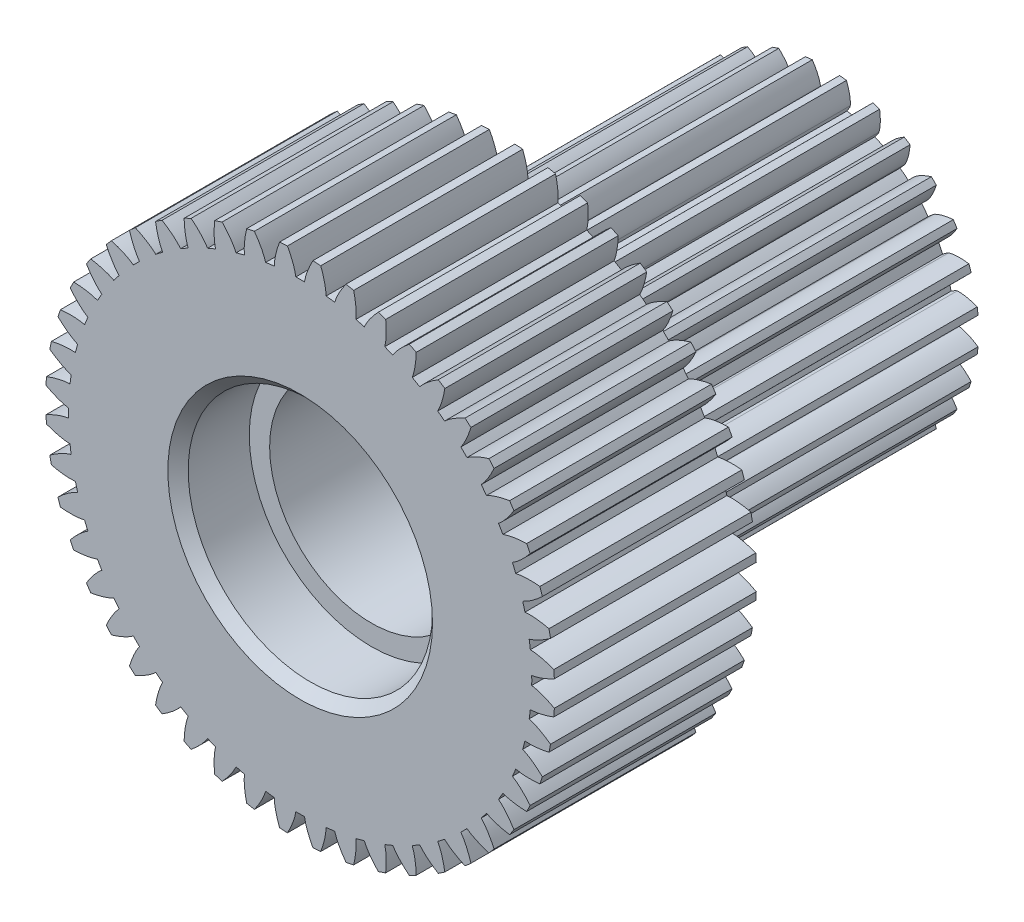
from build123d import *

# Parameters (mm, degrees)
SKETCH1_R           = 12.5
BOSS_EXTRUDE1_DEPTH = 4.959009305
CUT_EXTRUDE1_DEPTH  = 19.360059185
CIRPATTERN2_COUNT   = 48
SKETCH4_R           = 7.5
BOSS_EXTRUDE2_DEPTH = 15.90536252
CUT_EXTRUDE2_START  = -15.90536252
CUT_EXTRUDE2_DEPTH  = 15.90536252
CIRPATTERN3_COUNT   = 28
SKETCH3_R           = 5
CUT_EXTRUDE3_DEPTH  = 32.28205027
SKETCH7_R           = 6
CUT_EXTRUDE4_DEPTH  = 3.5
CHAMFER1_SIZE       = 0.5


with BuildPart() as part:
    # Sketch1 → Boss-Extrude1 (new, symmetric)
    with BuildSketch(Plane.XY):
        Circle(SKETCH1_R)
    extrude(amount=BOSS_EXTRUDE1_DEPTH, both=True)

    # Sketch2 → Cut-Extrude1 (cut, symmetric)
    with BuildSketch(Plane.XY):
        with BuildLine():
            ThreePointArc((11.375, 0), (11.374548456, -0.101352978), (11.373193859, -0.202697909))
            ThreePointArc((11.373193859, -0.202697909), (11.373112093, -0.207234919), (11.373028518, -0.211771896))
            add(Edge.make_bspline(
                [(11.373028518, -0.211771896), (11.380953526, -0.212987168), (11.401785423, -0.216332328), (11.441797627, -0.223452758), (11.500813641, -0.235700221), (11.57070435, -0.252432646), (11.646390258, -0.272969137), (11.721553813, -0.2955134), (11.796182124, -0.319908917), (11.870187127, -0.345925935), (11.959400335, -0.379458558), (12.065755817, -0.422467324), (12.189079832, -0.476789444), (12.31452904, -0.536847862), (12.406473441, -0.584161756), (12.462735627, -0.614203241), (12.484320484, -0.625893003)],
                knots=[0.035427308, 0.035427308, 0.035427308, 0.035427308, 0.035427308, 0.04661014, 0.064854849, 0.092110525, 0.119476176, 0.146842496, 0.174208854, 0.201574956, 0.228941013, 0.256307345, 0.307035032, 0.361767352, 0.416499661, 0.450790482, 0.450790482, 0.450790482, 0.450790482, 0.450790482], degree=4))
            ThreePointArc((12.484320484, -0.625893003), (12.496079506, -0.313044685), (12.5, 0))
            ThreePointArc((12.5, 0), (12.496095181, 0.312418356), (12.484383163, 0.624641521))
            add(Edge.make_bspline(
                [(11.373034654, 0.211442088), (11.381574139, 0.212737189), (11.403021273, 0.216159284), (11.443646662, 0.22337062), (11.503269369, 0.235743988), (11.573160079, 0.252476413), (11.648845987, 0.273012904), (11.724009541, 0.295557167), (11.798637852, 0.319952685), (11.872642856, 0.345969702), (11.961856063, 0.379502325), (12.068211545, 0.422511091), (12.191535561, 0.476833211), (12.316371806, 0.536598175), (12.40771357, 0.583580129), (12.463389424, 0.613285235), (12.484383163, 0.624641521)],
                knots=[0.034563274, 0.034563274, 0.034563274, 0.034563274, 0.034563274, 0.04661014, 0.064854849, 0.092110525, 0.119476176, 0.146842496, 0.174208854, 0.201574956, 0.228941013, 0.256307345, 0.307035032, 0.361767352, 0.416499661, 0.449840211, 0.449840211, 0.449840211, 0.449840211, 0.449840211], degree=4))
            ThreePointArc((11.373034654, 0.211442088), (11.373115097, 0.207070014), (11.373193859, 0.202697909))
            ThreePointArc((11.373193859, 0.202697909), (11.374548456, 0.101352978), (11.375, 0))
        make_face()
    cut_extrude1 = extrude(amount=CUT_EXTRUDE1_DEPTH, both=True, mode=Mode.SUBTRACT)

    # CirPattern2: Cut-Extrude1 ×48 about axis
    cirpattern2_axis = Axis((0, 0, 4.959009305), (0, 0, -1))
    for i in range(1, CIRPATTERN2_COUNT):
        add(cut_extrude1.rotate(cirpattern2_axis, i * 360 / CIRPATTERN2_COUNT), mode=Mode.SUBTRACT)

    # Sketch4 → Boss-Extrude2 (add)
    with BuildSketch(Plane(origin=(0, 0, -4.959009305), x_dir=(-1, 0, 0), z_dir=(0, 0, -1))):
        with Locations(Location((0, 0, 0), (0, 0, 180))):
            Circle(SKETCH4_R)
    extrude(amount=BOSS_EXTRUDE2_DEPTH)

    # Sketch5 → Cut-Extrude2 (cut)
    with BuildSketch(Plane(origin=(0, 0, -20.864371825), x_dir=(-1, 0, 0), z_dir=(0, 0, -1)).offset(CUT_EXTRUDE2_START)):
        with BuildLine():
            add(Edge.make_bspline(
                [(6.551938352, 0.270063067), (6.554183775, 0.270187999), (6.560475918, 0.270638437), (6.57986835, 0.272674717), (6.617963657, 0.2785042), (6.664698797, 0.288295188), (6.718076927, 0.302019538), (6.769252294, 0.317198106), (6.812778351, 0.331370124), (6.855967028, 0.346614448), (6.898770101, 0.362795891), (6.950339733, 0.38356759), (7.011777095, 0.410099248), (7.082955816, 0.443459913), (7.162899079, 0.48405589), (7.243467877, 0.52835254), (7.321979838, 0.574333574), (7.389051559, 0.616417202), (7.434953686, 0.64636796), (7.461977904, 0.664533304), (7.470015012, 0.669981878)],
                knots=[0, 0, 0, 0, 0, 0.005376749, 0.015083688, 0.04661014, 0.092110525, 0.119476176, 0.146842496, 0.174208854, 0.201574956, 0.228941013, 0.256307345, 0.307035032, 0.361767352, 0.416499661, 0.471231937, 0.525964282, 0.580696616, 0.603847904, 0.603847904, 0.603847904, 0.603847904, 0.603847904], degree=4))
            Line((6.551938352, 0.270063067), (6.369591361, 0.262546942))
            ThreePointArc((6.369591361, 0.262546942), (6.373647697, 0.131301323), (6.375, 0))
            ThreePointArc((6.375, 0), (6.373647697, -0.131301323), (6.369591361, -0.262546942))
            Line((6.369591361, -0.262546942), (6.551938352, -0.270063067))
            add(Edge.make_bspline(
                [(6.551938352, -0.270063067), (6.554183775, -0.270187999), (6.560475918, -0.270638437), (6.57986835, -0.272674717), (6.617963657, -0.2785042), (6.664698797, -0.288295188), (6.718076927, -0.302019538), (6.769252294, -0.317198106), (6.812778351, -0.331370124), (6.855967028, -0.346614448), (6.898770101, -0.362795891), (6.950339733, -0.38356759), (7.011777095, -0.410099248), (7.082955816, -0.443459913), (7.162899079, -0.48405589), (7.243467877, -0.52835254), (7.321979838, -0.574333574), (7.389051559, -0.616417202), (7.434953686, -0.64636796), (7.461977904, -0.664533304), (7.470015012, -0.669981878)],
                knots=[0, 0, 0, 0, 0, 0.005376749, 0.015083688, 0.04661014, 0.092110525, 0.119476176, 0.146842496, 0.174208854, 0.201574956, 0.228941013, 0.256307345, 0.307035032, 0.361767352, 0.416499661, 0.471231937, 0.525964282, 0.580696616, 0.603847904, 0.603847904, 0.603847904, 0.603847904, 0.603847904], degree=4))
            ThreePointArc((7.470015012, -0.669981878), (7.492500003, -0.335326265), (7.5, 0))
            ThreePointArc((7.5, 0), (7.492500003, 0.335326265), (7.470015012, 0.669981878))
        make_face()
    cut_extrude2 = extrude(amount=CUT_EXTRUDE2_DEPTH, mode=Mode.SUBTRACT)

    # CirPattern3: Cut-Extrude2 ×28 about axis
    cirpattern3_axis = Axis((0, 0, -20.864371825), (0, 0, 1))
    for i in range(1, CIRPATTERN3_COUNT):
        add(cut_extrude2.rotate(cirpattern3_axis, i * 360 / CIRPATTERN3_COUNT), mode=Mode.SUBTRACT)

    # Sketch3 → Cut-Extrude3 (cut, through all)
    with BuildSketch(Plane.XY.offset(4.959009305)):
        Circle(SKETCH3_R)
    extrude(amount=-CUT_EXTRUDE3_DEPTH, mode=Mode.SUBTRACT)

    # Sketch7 → Cut-Extrude4 (cut)
    with BuildSketch(Plane(origin=(0, 0, -20.864371825), x_dir=(-1, 0, 0), z_dir=(0, 0, -1))):
        Circle(SKETCH7_R)
    cut_extrude4 = extrude(amount=-CUT_EXTRUDE4_DEPTH, mode=Mode.SUBTRACT)

    # Mirror1: Cut-Extrude4 across plane
    add(cut_extrude4.mirror(Plane(origin=(0, 0, -7.95268126), x_dir=(1, 0, 0), z_dir=(0, 0, -1))), mode=Mode.SUBTRACT)

    # Chamfer1
    # the kernel refuses this chamfer: 0.5 mm, written as the material it takes off along each edge
    with BuildSketch(Plane(origin=(0, 0, 4.959009305), x_dir=(-1, 0, 0), z_dir=(0, -1, 0))) as chamfer1_piece_1:
        Polygon((6 + CHAMFER1_SIZE, 0), (6, CHAMFER1_SIZE), (6, 0), align=None)
    revolve(axis=Axis((0, 0, 4.959009305), (0, 0, -1)), mode=Mode.SUBTRACT)
    with BuildSketch(Plane(origin=(0, 0, -20.864371825), x_dir=(-1, 0, 0), z_dir=(0, -1, 0))) as chamfer1_piece_2:
        Polygon((6 + CHAMFER1_SIZE, 0), (6, -CHAMFER1_SIZE), (6, 0), align=None)
    revolve(axis=Axis((0, 0, -20.864371825), (0, 0, -1)), mode=Mode.SUBTRACT)


solid = part.part
